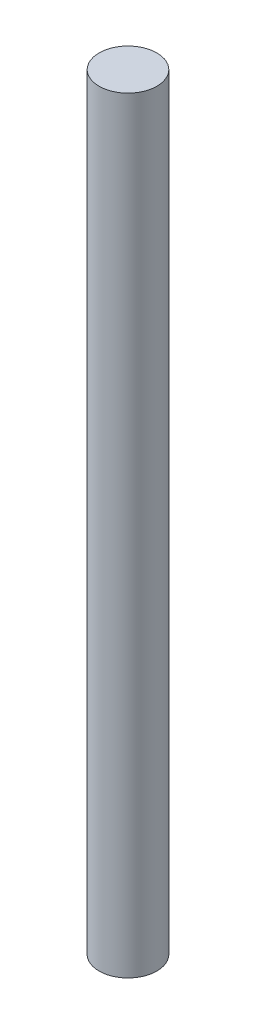
from build123d import *

# Parameters (mm, degrees)
TD_SKETCH_R      = 0.79248
TL_FEATURE_DEPTH = 21.0312


with BuildPart() as part:
    # TD_sketch → TL_feature (new body)
    with BuildSketch(Plane(origin=(0, 0, 0), x_dir=(1, 0, 0), z_dir=(0, 1, 0))):
        Circle(TD_SKETCH_R)
    extrude(amount=TL_FEATURE_DEPTH)


solid = part.part
